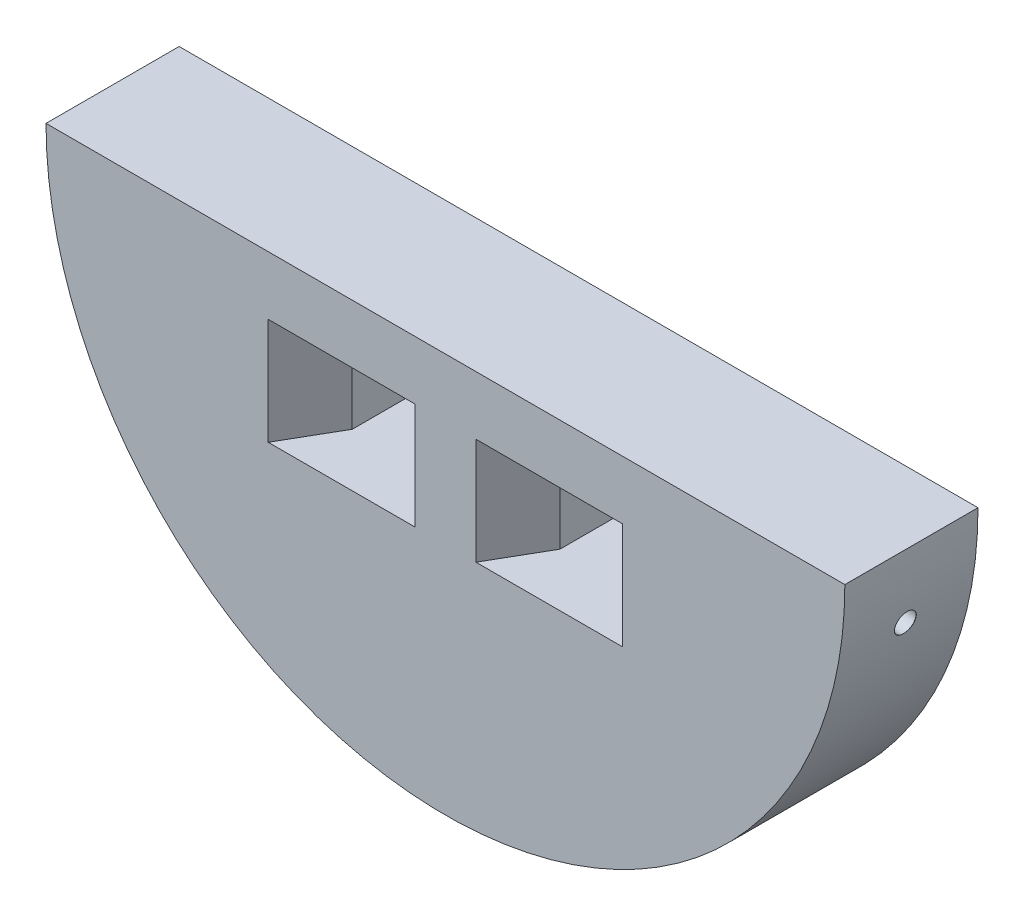
from build123d import *
from OCP.BRepFilletAPI import BRepFilletAPI_MakeChamfer

# Parameters (mm, degrees)
SKETCH1_W           = 16
SKETCH1_H           = 16
BOSS_EXTRUDE1_DEPTH = 25
CIRPATTERN1_COUNT   = 5
CIRPATTERN1_ANGLE   = 160
CHAMFER1_SIZE       = 15
CHAMFER1_SIZE2      = 8.660254038
CHAMFER3_SIZE       = 10
CHAMFER3_SIZE2      = 5.773502692
CHAMFER4_SIZE       = 4
CHAMFER4_SIZE2      = 6.92820323


with BuildPart() as part:
    # Sketch1 → Boss-Extrude1 (new body)
    with BuildSketch(Plane.XY):
        with BuildLine():
            Line((-150, 0), (0, 0))
            ThreePointArc((0, 0), (-75, -75), (-150, 0))
        make_face()
        with Locations((-55.5, -23)):
            Rectangle(SKETCH1_W, SKETCH1_H, mode=Mode.SUBTRACT)
        with Locations((-94.5, -23)):
            Rectangle(SKETCH1_W, SKETCH1_H, mode=Mode.SUBTRACT)
    extrude(amount=BOSS_EXTRUDE1_DEPTH)

    # Sketch4 → Ø4.0mm Dowel Hole2 (revolve, cut)
    with BuildSketch(Plane(origin=(-1.139418524, -13.023613325, 12.5), x_dir=(0.17364817766693047, 0.9848077530122081, 0), z_dir=(0, 0, 1))):
        Polygon((0, 0), (0, 17.201721238), (2, 16), (2, 0.025), (2.025, 0), align=None)
    f_4_0mm_dowel_hole2 = revolve(axis=Axis((5.114110708, -14.126279253, 12.5), (-0.9848077530122081, 0.17364817766693044, 0)), mode=Mode.SUBTRACT)

    # CirPattern1: Ø4.0mm Dowel Hole2 ×5 about axis
    cirpattern1_axis = Axis((-75, 0, 0), (0, 0, -1))
    for i in range(1, CIRPATTERN1_COUNT):
        add(f_4_0mm_dowel_hole2.rotate(cirpattern1_axis, i * CIRPATTERN1_ANGLE / (CIRPATTERN1_COUNT - 1)), mode=Mode.SUBTRACT)

    # Chamfer1: one chamfer whose edges measure the first distance from different faces: ONE call of the kernel's chamfer builder (chamfer() names one face for all edges)
    chamfer1_edges_1 = [part.edges().sort_by_distance(p)[0] for p in [
        (-94.5, -15, 0),
    ]]
    chamfer1_side_1 = [part.faces().sort_by_distance(p)[0] for p in [
        (-94.5, -15, 12.5),
    ]]
    chamfer1_edges_2 = [part.edges().sort_by_distance(p)[0] for p in [
        (-55.5, -15, 0),
    ]]
    chamfer1_side_2 = [part.faces().sort_by_distance(p)[0] for p in [
        (-55.5, -15, 12.5),
    ]]
    chamfer1 = BRepFilletAPI_MakeChamfer(part.part.solid().wrapped)
    for e in chamfer1_edges_1:
        chamfer1.Add(CHAMFER1_SIZE, CHAMFER1_SIZE2, e.wrapped, chamfer1_side_1[0].wrapped)  # the first distance lies on this face
    for e in chamfer1_edges_2:
        chamfer1.Add(CHAMFER1_SIZE, CHAMFER1_SIZE2, e.wrapped, chamfer1_side_2[0].wrapped)  # the first distance lies on this face
    add(Compound.cast(chamfer1.Shape()), mode=Mode.REPLACE)

    # Chamfer3: one chamfer whose edges measure the first distance from different faces: ONE call of the kernel's chamfer builder (chamfer() names one face for all edges)
    chamfer3_edges_1 = [part.edges().sort_by_distance(p)[0] for p in [
        (-102.5, -23, 25),
    ]]
    chamfer3_side_1 = [part.faces().sort_by_distance(p)[0] for p in [
        (-102.5, -21.47916476, 11.452280259),
    ]]
    chamfer3_edges_2 = [part.edges().sort_by_distance(p)[0] for p in [
        (-86.5, -23, 25),
    ]]
    chamfer3_side_2 = [part.faces().sort_by_distance(p)[0] for p in [
        (-86.5, -21.47916476, 11.452280259),
    ]]
    chamfer3_edges_3 = [part.edges().sort_by_distance(p)[0] for p in [
        (-47.5, -23, 25),
    ]]
    chamfer3_side_3 = [part.faces().sort_by_distance(p)[0] for p in [
        (-47.5, -21.47916476, 11.452280259),
    ]]
    chamfer3_edges_4 = [part.edges().sort_by_distance(p)[0] for p in [
        (-63.5, -23, 25),
    ]]
    chamfer3_side_4 = [part.faces().sort_by_distance(p)[0] for p in [
        (-63.5, -21.47916476, 11.452280259),
    ]]
    chamfer3 = BRepFilletAPI_MakeChamfer(part.part.solid().wrapped)
    for e in chamfer3_edges_1:
        chamfer3.Add(CHAMFER3_SIZE, CHAMFER3_SIZE2, e.wrapped, chamfer3_side_1[0].wrapped)  # the first distance lies on this face
    for e in chamfer3_edges_2:
        chamfer3.Add(CHAMFER3_SIZE, CHAMFER3_SIZE2, e.wrapped, chamfer3_side_2[0].wrapped)  # the first distance lies on this face
    for e in chamfer3_edges_3:
        chamfer3.Add(CHAMFER3_SIZE, CHAMFER3_SIZE2, e.wrapped, chamfer3_side_3[0].wrapped)  # the first distance lies on this face
    for e in chamfer3_edges_4:
        chamfer3.Add(CHAMFER3_SIZE, CHAMFER3_SIZE2, e.wrapped, chamfer3_side_4[0].wrapped)  # the first distance lies on this face
    add(Compound.cast(chamfer3.Shape()), mode=Mode.REPLACE)

    # Chamfer4
    chamfer4_edges = [part.edges().sort_by_distance(p)[0] for p in [
        (-55.5, -15, 25),
        (-94.5, -15, 25),
    ]]
    chamfer4_side = [part.faces().sort_by_distance(p)[0] for p in [
        (-75, -32.809657584, 25),
    ]]
    chamfer(chamfer4_edges, length=CHAMFER4_SIZE, length2=CHAMFER4_SIZE2, reference=chamfer4_side[0])


solid = part.part
